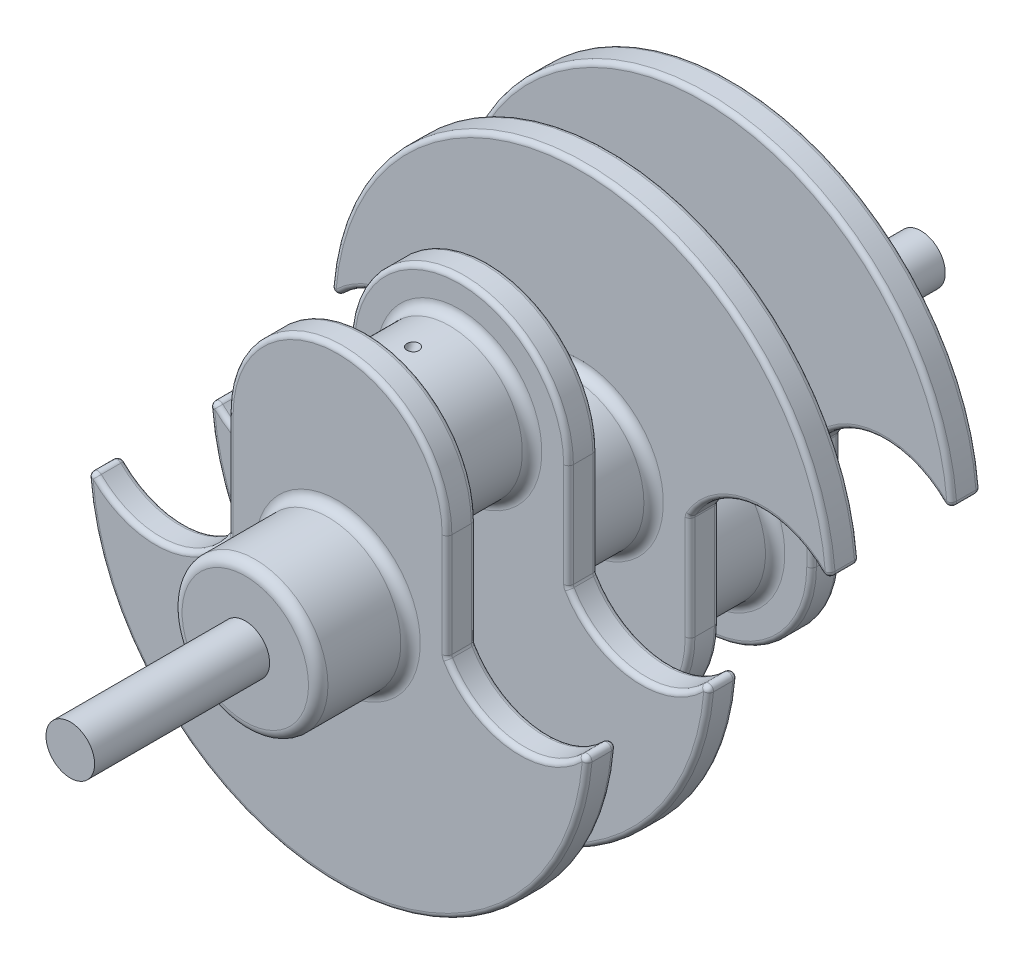
from build123d import *
from build123d.topology import SkipClean

# Parameters (mm, degrees)
SKETCH1_R               = 30
BOSS_EXTRUDE1_DEPTH     = 38
BOSS_EXTRUDE5_DEPTH     = 12
SKETCH2_R               = 10
BOSS_EXTRUDE2_DEPTH     = 20
SKETCH9_R               = 30
BOSS_EXTRUDE6_DEPTH     = 38
BOSS_EXTRUDE7_START     = 50
BOSS_EXTRUDE7_DEPTH     = 12
BOSS_EXTRUDE8_DEPTH     = 12
BOSS_EXTRUDE9_REACH     = 225.994
SKETCH14_R              = 30
BOSS_EXTRUDE10_START    = 38
SKETCH15_R              = 30
BOSS_EXTRUDE10_DEPTH    = 38
BOSS_EXTRUDE11_START    = 40
SKETCH16_R              = 10
BOSS_EXTRUDE11_DEPTH    = 40
BOSS_EXTRUDE12_DEPTH    = 12
BOSS_EXTRUDE13_REACH    = 232.125
SKETCH19_R              = 30
FILLET1_R               = 2
FILLET2_R               = 2
FILLET3_R               = 2
FILLET5_R               = 4
FILLET6_R               = 4
FILLET7_R               = 4
CUT_EXTRUDE2_DEPTH      = 309.845878772
CUT_EXTRUDE2_DEPTH_BACK = 309.845878772
SKETCH48_RX             = 2.5
SKETCH48_RY             = 2.249846385
CUT_EXTRUDE3_DEPTH      = 279.225561271
CUT_EXTRUDE3_DEPTH_BACK = 279.225561271
SKETCH49_R              = 2.5
SKETCH53_R              = 10
BOSS_EXTRUDE14_DEPTH    = 52


with BuildPart() as part:
    # Sketch1 → Boss-Extrude1 (new body)
    with BuildSketch(Plane.XY):
        Circle(SKETCH1_R)
    extrude(amount=BOSS_EXTRUDE1_DEPTH)

    # Sketch8 → Boss-Extrude5 (add)
    with BuildSketch(Plane(origin=(0, 0, 0), x_dir=(-1, 0, 0), z_dir=(0, 0, -1))):
        with BuildLine():
            Line((-45, 43.2), (-45, 0))
            ThreePointArc((-45, 0), (-73.159070608, -17.4070921), (-102.964704472, -3))
            ThreePointArc((-102.964704472, -3), (0, -103.303774324), (102.964704472, -3))
            ThreePointArc((102.964704472, -3), (73.159070608, -17.4070921), (45, 0))
            Line((45, 0), (45, 43.2))
            ThreePointArc((45, 43.2), (0, 88.2), (-45, 43.2))
        make_face()
    extrude(amount=BOSS_EXTRUDE5_DEPTH)

    # Sketch2 → Boss-Extrude2 (add)
    with BuildSketch(Plane.XY.offset(38)):
        Circle(SKETCH2_R)
    extrude(amount=BOSS_EXTRUDE2_DEPTH)

    # Sketch9 → Boss-Extrude6 (add)
    with BuildSketch(Plane(origin=(0, 0, -12), x_dir=(-1, 0, 0), z_dir=(0, 0, -1))):
        with Locations((0, 43.2)):
            Circle(SKETCH9_R)
    extrude(amount=BOSS_EXTRUDE6_DEPTH)

    # Sketch18 → Boss-Extrude12 (add)
    with BuildSketch(Plane(origin=(0, 0, -50), x_dir=(-1, 0, 0), z_dir=(0, 0, -1))):
        with BuildLine():
            Line((-45, 43.2), (-45, 0))
            ThreePointArc((-45, 0), (-73.159070608, -17.4070921), (-102.964704472, -3))
            ThreePointArc((-102.964704472, -3), (0, -103.303774324), (102.964704472, -3))
            ThreePointArc((102.964704472, -3), (73.159070608, -17.4070921), (45, 0))
            Line((45, 0), (45, 43.2))
            ThreePointArc((45, 43.2), (0, 88.2), (-45, 43.2))
        make_face()
    extrude(amount=BOSS_EXTRUDE12_DEPTH)



with BuildPart() as body_2:
    # Sketch10 → Boss-Extrude7 (new body)
    with BuildSketch(Plane(origin=(0, 0, -50), x_dir=(-1, 0, 0), z_dir=(0, 0, -1)).offset(BOSS_EXTRUDE7_START)):
        with BuildLine():
            Line((-45, -43.2), (-45, 0))
            ThreePointArc((-45, 0), (-73.159070608, 17.4070921), (-102.964704472, 3))
            ThreePointArc((-102.964704472, 3), (0, 103.303774324), (102.964704472, 3))
            ThreePointArc((102.964704472, 3), (73.159070608, 17.4070921), (45, 0))
            Line((45, 0), (45, -43.2))
            ThreePointArc((45, -43.2), (0, -88.2), (-45, -43.2))
        make_face()
    extrude(amount=BOSS_EXTRUDE7_DEPTH)


with BuildPart() as body_3:
    # Sketch12 → Boss-Extrude8 (new body)
    with BuildSketch(Plane(origin=(0, 0, -150), x_dir=(-1, 0, 0), z_dir=(0, 0, -1))):
        with BuildLine():
            Line((45, -43.2), (45, 0))
            ThreePointArc((45, 0), (73.159070608, 17.4070921), (102.964704472, 3))
            ThreePointArc((102.964704472, 3), (0, 103.303774324), (-102.964704472, 3))
            ThreePointArc((-102.964704472, 3), (-73.159070608, 17.4070921), (-45, 0))
            Line((-45, 0), (-45, -43.2))
            ThreePointArc((-45, -43.2), (0, -88.2), (45, -43.2))
        make_face()
    extrude(amount=BOSS_EXTRUDE8_DEPTH)

    # Sketch14 → Boss-Extrude9 (add, up to next)
    with BuildSketch(Plane(origin=(0, 0, -112), x_dir=(-1, 0, 0), z_dir=(0, 0, -1)), mode=Mode.PRIVATE) as boss_extrude9_sk1:
        with Locations(Location((0, -43.2, 0), (0, 0, 180))):
            Circle(SKETCH14_R)
    boss_extrude9_tool1 = extrude(boss_extrude9_sk1.sketch, amount=BOSS_EXTRUDE9_REACH, mode=Mode.PRIVATE) - body_3.part
    add(boss_extrude9_tool1.solids().sort_by_distance((0, -43.2, -112))[0])

    # Sketch15 → Boss-Extrude10 (add)
    with BuildSketch(Plane(origin=(0, 0, -162), x_dir=(-1, 0, 0), z_dir=(0, 0, -1)).offset(BOSS_EXTRUDE10_START)):
        Circle(SKETCH15_R)
    extrude(amount=-BOSS_EXTRUDE10_DEPTH)

    # Sketch16 → Boss-Extrude11 (add)
    with BuildSketch(Plane(origin=(0, 0, -200), x_dir=(-1, 0, 0), z_dir=(0, 0, -1)).offset(BOSS_EXTRUDE11_START)):
        Circle(SKETCH16_R)
    extrude(amount=-BOSS_EXTRUDE11_DEPTH)

    # Fillet2
    fillet2_edges = [body_3.edges().sort_by_distance(p)[0] for p in [
        (-102.964704472, 3, -156),
        (-45, 0, -156),
        (45, 0, -156),
        (102.964704472, 3, -156),
        (45, -21.6, -162),
        (0, -88.2, -162),
        (-45, -21.6, -162),
        (-73.159070608, 17.4070921, -162),
        (0, 103.303774324, -162),
        (-73.159070608, 17.4070921, -150),
        (-45, -21.6, -150),
        (0, -88.2, -150),
        (45, -21.6, -150),
        (73.159070608, 17.4070921, -150),
        (0, 103.303774324, -150),
        (73.159070608, 17.4070921, -162),
    ]]
    fillet(fillet2_edges, radius=FILLET2_R)

    # Fillet6
    fillet6_edges = [body_3.edges().sort_by_distance(p)[0] for p in [
        (30, 0, -162),
        (30, 0, -200),
    ]]
    fillet(fillet6_edges, radius=FILLET6_R)


with BuildPart() as part_1:
    add(part.part)

    # Sketch19 → Boss-Extrude13 (add, up to next)
    with BuildSketch(Plane(origin=(0, 0, -62), x_dir=(-1, 0, 0), z_dir=(0, 0, -1)), mode=Mode.PRIVATE) as boss_extrude13_sk1:
        Circle(SKETCH19_R)
    boss_extrude13_tool1 = extrude(boss_extrude13_sk1.sketch, amount=BOSS_EXTRUDE13_REACH, mode=Mode.PRIVATE) - body_2.part
    add(boss_extrude13_tool1.solids().sort_by_distance((0, 0, -62))[0])

    # Fillet1
    fillet1_edges = [part_1.edges().sort_by_distance(p)[0] for p in [
        (-45, 21.6, -12),
        (0, -103.303774324, -50),
        (102.964704472, -3, -56),
        (-73.159070608, -17.4070921, -50),
        (-102.964704472, -3, -56),
        (-45, 21.6, -50),
        (-45, 0, -56),
        (0, 88.2, -50),
        (45, 21.6, -50),
        (73.159070608, -17.4070921, -50),
        (45, 0, -56),
        (0, -103.303774324, -62),
        (-73.159070608, -17.4070921, -62),
        (-45, 21.6, -62),
        (0, 88.2, -62),
        (45, 21.6, -62),
        (73.159070608, -17.4070921, -62),
        (0, 88.2, 0),
        (45, 21.6, 0),
        (73.159070608, -17.4070921, 0),
        (45, 0, -6),
        (0, -103.303774324, 0),
        (102.964704472, -3, -6),
        (-73.159070608, -17.4070921, 0),
        (-102.964704472, -3, -6),
        (-45, 21.6, 0),
        (-45, 0, -6),
        (0, 88.2, -12),
        (45, 21.6, -12),
        (73.159070608, -17.4070921, -12),
        (0, -103.303774324, -12),
        (-73.159070608, -17.4070921, -12),
    ]]
    fillet(fillet1_edges, radius=FILLET1_R)

    # Fillet5
    fillet5_edges = [part_1.edges().sort_by_distance(p)[0] for p in [
        (-30, 0, 38),
        (-30, 0, 0),
    ]]
    fillet(fillet5_edges, radius=FILLET5_R)


with BuildPart() as body_2_1:
    add(body_2.part)

    # Fillet3
    fillet3_edges = [body_2_1.edges().sort_by_distance(p)[0] for p in [
        (-45, 0, -106),
        (-102.964704472, 3, -106),
        (102.964704472, 3, -106),
        (45, 0, -106),
        (0, 103.303774324, -112),
        (-73.159070608, 17.4070921, -112),
        (-45, -21.6, -112),
        (0, -88.2, -112),
        (45, -21.6, -112),
        (0, -88.2, -100),
        (-45, -21.6, -100),
        (-73.159070608, 17.4070921, -100),
        (0, 103.303774324, -100),
        (73.159070608, 17.4070921, -100),
        (45, -21.6, -100),
        (73.159070608, 17.4070921, -112),
    ]]
    fillet(fillet3_edges, radius=FILLET3_R)


with BuildPart() as part_2:
    add(part_1.part)

    # Combine1: union body 2, body 3
    add(body_2_1.part)
    add(body_3.part)

    # Fillet7
    fillet7_edges = [part_2.edges().sort_by_distance(p)[0] for p in [
        (-30, -43.2, -112),
        (-30, -43.2, -150),
        (30, 43.2, -12),
        (30, 43.2, -50),
        (30, 0, -62),
        (30, 0, -100),
    ]]
    fillet(fillet7_edges, radius=FILLET7_R)

    # Sketch48 → Cut-Extrude2 (cut, two sides: drawn at the far end of the back side and taken through both)
    with BuildSketch(Plane(origin=(0, -30, 19), x_dir=(-1, 0, 0), z_dir=(0, -0.8999385541569358, 0.43601674135510465)).offset(-CUT_EXTRUDE2_DEPTH_BACK)):
        with Locations((0, 0)):
            Ellipse(SKETCH48_RX, SKETCH48_RY)
    extrude(amount=CUT_EXTRUDE2_DEPTH + CUT_EXTRUDE2_DEPTH_BACK, mode=Mode.SUBTRACT)

    # Sketch49 → Cut-Extrude3 (cut, two sides: drawn at the far end of the back side and taken through both)
    with BuildSketch(Plane(origin=(0, -73.2, -131), x_dir=(-1, 0, 0), z_dir=(0, -0.9027810023666893, 0.4301005251866075)).offset(-CUT_EXTRUDE3_DEPTH_BACK)):
        with Locations(Location((0, 0, 0), (0, 0, 90))):
            Circle(SKETCH49_R)
    extrude(amount=CUT_EXTRUDE3_DEPTH + CUT_EXTRUDE3_DEPTH_BACK, mode=Mode.SUBTRACT)

    # Sketch53 → Boss-Extrude14 (add)
    with SkipClean():  # the faces are left unmerged after this step: merging them gives an invalid solid
        with BuildSketch(Plane(origin=(0, 0, 58), x_dir=(-1, 0, 0), z_dir=(0, 0, -1))):
            Circle(SKETCH53_R)
        extrude(amount=-BOSS_EXTRUDE14_DEPTH)
    add(part_2.part.scale(1), mode=Mode.REPLACE)  # the faces are merged on a copy


solid = part_2.part
